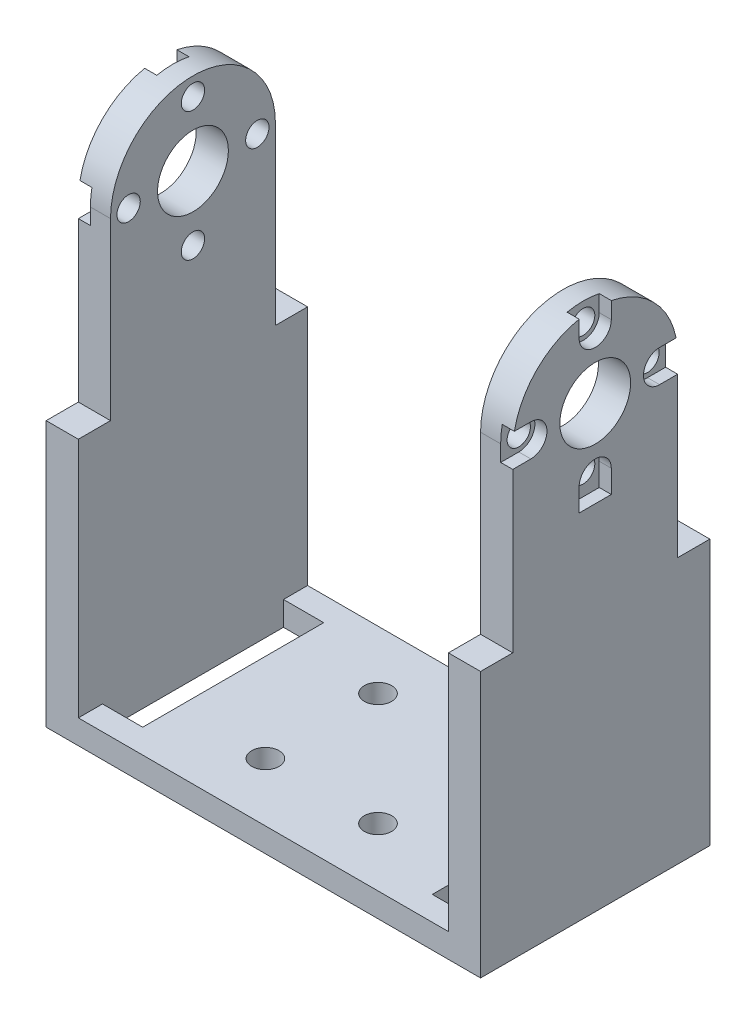
from build123d import *

# Parameters (mm, degrees)
SKETCH1_W           = 54
SKETCH1_H           = 28.5
SKETCH1_W_2         = 5
SKETCH1_H_2         = 22.5
SKETCH1_R           = 1.7
SKETCH1_R_2         = 7.5
BOSS_EXTRUDE2_DEPTH = 3
SKETCH2_W           = 4
SKETCH2_H           = 20.5
BOSS_EXTRUDE3_DEPTH = 21.75
SKETCH4_R           = 10.25
BOSS_EXTRUDE4_DEPTH = 4
SKETCH6_R           = 4.4
SKETCH6_R_2         = 1.45
CUT_EXTRUDE3_DEPTH  = 4
SKETCH7_R           = 1.45
CUT_EXTRUDE4_DEPTH  = 1.5
SKETCH8_W           = 28.781481152
SKETCH8_H           = 28.5
BOSS_EXTRUDE5_DEPTH = 3
SKETCH9_R           = 1.7
CUT_EXTRUDE5_DEPTH  = 3
SKETCH10_W          = 54
SKETCH10_H          = 28.5
SKETCH10_R          = 1.7
SKETCH10_W_2        = 5
SKETCH10_H_2        = 22.5
BOSS_EXTRUDE7_DEPTH = 30
SKETCH11_W          = 46
SKETCH11_H          = 30
CUT_EXTRUDE6_DEPTH  = 30


with BuildPart() as part:
    # Sketch1 → Boss-Extrude2 (new body)
    with BuildSketch(Plane(origin=(0, 0, 0), x_dir=(1, 0, 0), z_dir=(0, 1, 0))):
        Rectangle(SKETCH1_W, SKETCH1_H)
        with Locations((20.5, 0)):
            Rectangle(SKETCH1_W_2, SKETCH1_H_2, mode=Mode.SUBTRACT)
        with Locations((-20.5, 0)):
            Rectangle(SKETCH1_W_2, SKETCH1_H_2, mode=Mode.SUBTRACT)
        with Locations((-9, -8.25)):
            Circle(SKETCH1_R, mode=Mode.SUBTRACT)
        with Locations((9, -8.25)):
            Circle(SKETCH1_R, mode=Mode.SUBTRACT)
        with Locations((-9, 8.25)):
            Circle(SKETCH1_R, mode=Mode.SUBTRACT)
        Circle(SKETCH1_R_2, mode=Mode.SUBTRACT)
        with Locations((9, 8.25)):
            Circle(SKETCH1_R, mode=Mode.SUBTRACT)
    extrude(amount=BOSS_EXTRUDE2_DEPTH)

    # Sketch2 → Boss-Extrude3 (add)
    with BuildSketch(Plane(origin=(0, 3, 0), x_dir=(1, 0, 0), z_dir=(0, 1, 0))):
        with Locations((25, 0)):
            Rectangle(SKETCH2_W, SKETCH2_H)
    boss_extrude3 = extrude(amount=BOSS_EXTRUDE3_DEPTH)

    # Sketch4 → Boss-Extrude4 (add)
    with BuildSketch(Plane(origin=(27, 0, 0), x_dir=(0, 0, -1), z_dir=(1, 0, 0))):
        with Locations((0, 24.75)):
            Circle(SKETCH4_R)
    boss_extrude4 = extrude(amount=-BOSS_EXTRUDE4_DEPTH)

    # Mirror1: Boss-Extrude3, Boss-Extrude4 across plane
    add(boss_extrude3.mirror(Plane(origin=(0, 0, 0), x_dir=(0, 0, 1), z_dir=(1, 0, 0))))
    add(boss_extrude4.mirror(Plane(origin=(0, 0, 0), x_dir=(0, 0, 1), z_dir=(1, 0, 0))))

    # Sketch6 → Cut-Extrude3 (cut)
    with BuildSketch(Plane(origin=(27, 0, 0), x_dir=(0, 0, -1), z_dir=(1, 0, 0))):
        with Locations((0, 24.75)):
            Circle(SKETCH6_R)
        with Locations((8, 24.75)):
            Circle(SKETCH6_R_2)
        with Locations((0, 32.75)):
            Circle(SKETCH6_R_2)
        with Locations((0, 16.75)):
            Circle(SKETCH6_R_2)
        with Locations((-8, 24.75)):
            Circle(SKETCH6_R_2)
    cut_extrude3 = extrude(amount=-CUT_EXTRUDE3_DEPTH, mode=Mode.SUBTRACT)

    # Mirror3: Cut-Extrude3 across plane
    add(cut_extrude3.mirror(Plane(origin=(0, 0, 0), x_dir=(0, 0, 1), z_dir=(1, 0, 0))), mode=Mode.SUBTRACT)

    # Sketch7 → Cut-Extrude4 (cut)
    # profile 1 of 4: a face of its own
    with BuildSketch(Plane(origin=(27, 0, 0), x_dir=(0, 0, -1), z_dir=(1, 0, 0))):
        with BuildLine():
            ThreePointArc((10.25, 24.75), (10.200627247, 25.754840168), (10.052984631, 26.75))
            Line((10.052984631, 26.75), (8, 26.75))
            ThreePointArc((8, 26.75), (6, 24.75), (8, 22.75))
            Line((8, 22.75), (10.25, 22.75))
            Line((10.25, 22.75), (10.25, 24.75))
        make_face()
        with Locations((8, 24.75)):
            Circle(SKETCH7_R, mode=Mode.SUBTRACT)
    # profile 2 of 4: a face of its own
    with BuildSketch(Plane(origin=(27, 0, 0), x_dir=(0, 0, -1), z_dir=(1, 0, 0))):
        with BuildLine():
            Line((-2, 35.572359929), (-2, 32.75))
            ThreePointArc((-2, 32.75), (0, 30.75), (2, 32.75))
            Line((2, 32.75), (2, 35.572359929))
            Line((2, 35.572359929), (-2, 35.572359929))
        make_face()
        with Locations((0, 32.75)):
            Circle(SKETCH7_R, mode=Mode.SUBTRACT)
    # profile 3 of 4: a face of its own
    with BuildSketch(Plane(origin=(27, 0, 0), x_dir=(0, 0, -1), z_dir=(1, 0, 0))):
        with BuildLine():
            Line((-8, 26.75), (-10.052984631, 26.75))
            ThreePointArc((-10.052984631, 26.75), (-10.200627247, 25.754840168), (-10.25, 24.75))
            Line((-10.25, 24.75), (-10.25, 22.75))
            Line((-10.25, 22.75), (-8, 22.75))
            ThreePointArc((-8, 22.75), (-6, 24.75), (-8, 26.75))
        make_face()
        with Locations((-8, 24.75)):
            Circle(SKETCH7_R, mode=Mode.SUBTRACT)
    # profile 4 of 4: a face of its own
    with BuildSketch(Plane(origin=(27, 0, 0), x_dir=(0, 0, -1), z_dir=(1, 0, 0))):
        with BuildLine():
            ThreePointArc((2, 16.75), (0, 18.75), (-2, 16.75))
            Line((-2, 16.75), (-2, 13.927640071))
            Line((-2, 13.927640071), (2, 13.927640071))
            Line((2, 13.927640071), (2, 16.75))
        make_face()
        with Locations((0, 16.75)):
            Circle(SKETCH7_R, mode=Mode.SUBTRACT)
    cut_extrude4 = extrude(amount=-CUT_EXTRUDE4_DEPTH, mode=Mode.SUBTRACT)

    # Mirror4: Cut-Extrude4 across plane
    add(cut_extrude4.mirror(Plane(origin=(0, 0, 0), x_dir=(0, 0, 1), z_dir=(1, 0, 0))), mode=Mode.SUBTRACT)

    # Sketch8 → Boss-Extrude5 (add)
    with BuildSketch(Plane(origin=(0, 3, 0), x_dir=(1, 0, 0), z_dir=(0, 1, 0))):
        Rectangle(SKETCH8_W, SKETCH8_H)
    extrude(amount=-BOSS_EXTRUDE5_DEPTH)

    # Sketch9 → Cut-Extrude5 (cut)
    with BuildSketch(Plane(origin=(0, 3, 0), x_dir=(1, 0, 0), z_dir=(0, 1, 0))):
        with Locations((-7, 7)):
            Circle(SKETCH9_R)
        with Locations((7, 7)):
            Circle(SKETCH9_R)
        with Locations((-7, -7)):
            Circle(SKETCH9_R)
        with Locations((7, -7)):
            Circle(SKETCH9_R)
    extrude(amount=-CUT_EXTRUDE5_DEPTH, mode=Mode.SUBTRACT)

    # Sketch10 → Boss-Extrude7 (add)
    with BuildSketch(Plane.XZ):
        Rectangle(SKETCH10_W, SKETCH10_H)
        with Locations((-7, 7)):
            Circle(SKETCH10_R, mode=Mode.SUBTRACT)
        with Locations((7, 7)):
            Circle(SKETCH10_R, mode=Mode.SUBTRACT)
        with Locations((7, -7)):
            Circle(SKETCH10_R, mode=Mode.SUBTRACT)
        with Locations((-7, -7)):
            Circle(SKETCH10_R, mode=Mode.SUBTRACT)
        with Locations((-20.5, 0)):
            Rectangle(SKETCH10_W_2, SKETCH10_H_2, mode=Mode.SUBTRACT)
        with Locations((20.5, 0)):
            Rectangle(SKETCH10_W_2, SKETCH10_H_2, mode=Mode.SUBTRACT)
    extrude(amount=BOSS_EXTRUDE7_DEPTH)

    # Sketch11 → Cut-Extrude6 (cut)
    with BuildSketch(Plane.XY.offset(14.25)):
        with Locations((0, -12)):
            Rectangle(SKETCH11_W, SKETCH11_H)
    extrude(amount=-CUT_EXTRUDE6_DEPTH, mode=Mode.SUBTRACT)


solid = part.part
